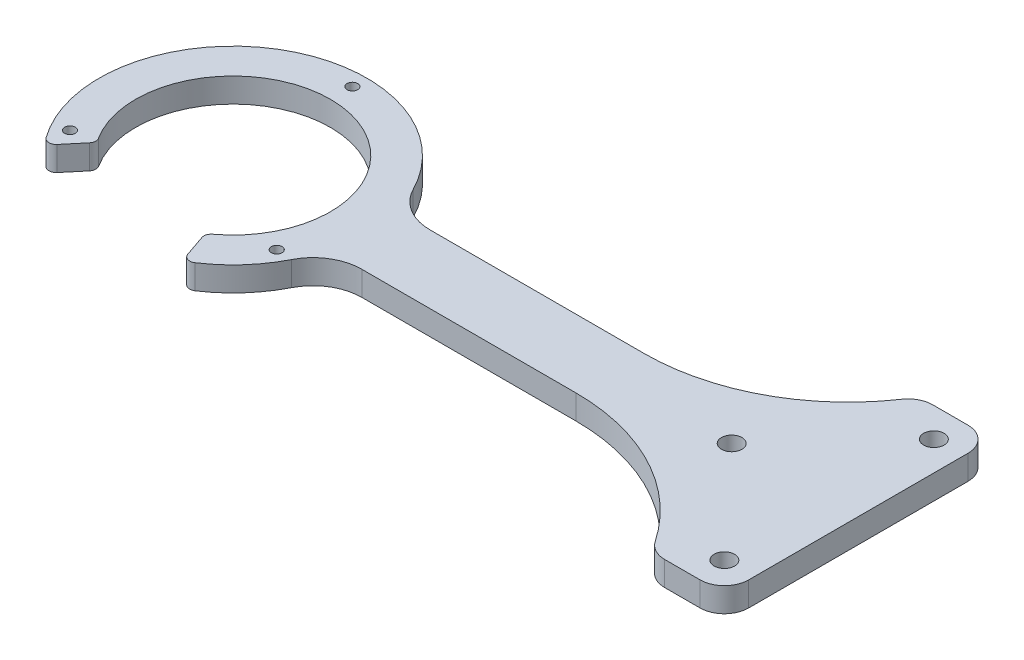
from build123d import *

# Parameters (mm, degrees)
SKETCH_1_R          = 4.5
EXTRUDE_1_DEPTH     = 5
SKETCH_2_R          = 2.1
SKETCH_2_R_2        = 4.5
EXTRUDE_2_DEPTH     = 5
FILLET_1_R          = 5
SKETCH_4_R          = 27.5
SKETCH_4_R_2        = 1.1
SKETCH_4_R_3        = 20
EXTRUDE_3_DEPTH     = 5
SKETCH_5_R          = 20
CUT_EXTRUDE_1_DEPTH = 5
FILLET_2_R          = 10
CUT_EXTRUDE_START   = -5
CUT_EXTRUDE_3_DEPTH = 5
FILLET_3_R          = 1.5


with BuildPart() as part:
    # 草图1 → 凸台-拉伸1 (new body)
    with BuildSketch(Plane(origin=(0, 0, 0), x_dir=(1, 0, 0), z_dir=(0, 1, 0))):
        with BuildLine():
            Line((-102.35, 7), (0, 7))
            ThreePointArc((0, 7), (7, 0), (0, -7))
            Line((0, -7), (-102.35, -7))
            ThreePointArc((-102.35, -7), (-109.35, 0), (-102.35, 7))
        make_face()
        with Locations((-102.35, 0)):
            Circle(SKETCH_1_R, mode=Mode.SUBTRACT)
        Circle(SKETCH_1_R, mode=Mode.SUBTRACT)
    extrude(amount=EXTRUDE_1_DEPTH)

    # 草图2 → 凸台-拉伸2 (add)
    # profile 1 of 2: a face of its own
    with BuildSketch(Plane.XZ):
        with BuildLine():
            Line((26, 27.5), (11, 27.5))
            ThreePointArc((11, 27.5), (-4.286176114, 12.484260492), (-25, 7))
            Line((-25, 7), (0, 7))
            ThreePointArc((0, 7), (7, 0), (0, -7))
            Line((0, -7), (-25, -7))
            ThreePointArc((-25, -7), (-4.286176114, -12.484260492), (11, -27.5))
            Line((11, -27.5), (26, -27.5))
            Line((26, -27.5), (26, 27.5))
        make_face()
        with Locations((20, -21.5)):
            Circle(SKETCH_2_R, mode=Mode.SUBTRACT)
        with Locations((20, 21.5)):
            Circle(SKETCH_2_R, mode=Mode.SUBTRACT)
    # profile 2 of 2: a face of its own
    with BuildSketch(Plane.XZ):
        Circle(SKETCH_2_R_2)
        Circle(SKETCH_2_R, mode=Mode.SUBTRACT)
    extrude(amount=-EXTRUDE_2_DEPTH)

    # 圆角1
    fillet_1_edges = [part.edges().sort_by_distance(p)[0] for p in [
        (11, 2.5, -27.5),
        (26, 2.5, 27.5),
        (11, 2.5, 27.5),
        (26, 2.5, -27.5),
    ]]
    fillet(fillet_1_edges, radius=FILLET_1_R)

    # 草图4 → 凸台-拉伸3 (add)
    with BuildSketch(Plane(origin=(0, 5, 0), x_dir=(1, 0, 0), z_dir=(0, 1, 0))):
        with Locations((-102.35, 0)):
            Circle(SKETCH_4_R)
        with Locations((-102.35, 24.5)):
            Circle(SKETCH_4_R_2, mode=Mode.SUBTRACT)
        with Locations((-81.132377607, -12.25)):
            Circle(SKETCH_4_R_2, mode=Mode.SUBTRACT)
        with Locations((-123.567622393, -12.25)):
            Circle(SKETCH_4_R_2, mode=Mode.SUBTRACT)
        with Locations((-102.35, 0)):
            Circle(SKETCH_4_R_3, mode=Mode.SUBTRACT)
    extrude(amount=-EXTRUDE_3_DEPTH)

    # 草图5 → 切除-拉伸1 (cut)
    with BuildSketch(Plane(origin=(0, 5, 0), x_dir=(1, 0, 0), z_dir=(0, 1, 0))):
        with Locations((-102.35, 0)):
            Circle(SKETCH_5_R)
    extrude(amount=-CUT_EXTRUDE_1_DEPTH, mode=Mode.SUBTRACT)

    # 圆角2
    fillet_2_edges = [part.edges().sort_by_distance(p)[0] for p in [
        (-75.755827706, 2.5, -7),
        (-75.755827706, 2.5, 7),
    ]]
    fillet(fillet_2_edges, radius=FILLET_2_R)

    # 草图7 → 切除-拉伸3 (cut)
    with BuildSketch(Plane.XZ.offset(CUT_EXTRUDE_START)):
        with BuildLine():
            Line((-91.33718236, 16.694844942), (-88.846316345, 23.956221066))
            ThreePointArc((-88.846316345, 23.956221066), (-107.377172664, 27.036596217), (-123.56224986, 17.501155844))
            Line((-123.56224986, 17.501155844), (-118.627750753, 11.620448805))
            ThreePointArc((-118.627750753, 11.620448805), (-106.006125574, 19.662979067), (-91.33718236, 16.694844942))
        make_face()
    extrude(amount=CUT_EXTRUDE_3_DEPTH, mode=Mode.SUBTRACT)

    # 圆角3
    fillet_3_edges = [part.edges().sort_by_distance(p)[0] for p in [
        (-88.846316345, 2.5, 23.956221066),
        (-123.56224986, 2.5, 17.501155844),
        (-118.627750753, 2.5, 11.620448805),
        (-91.33718236, 2.5, 16.694844942),
    ]]
    fillet(fillet_3_edges, radius=FILLET_3_R)


solid = part.part
